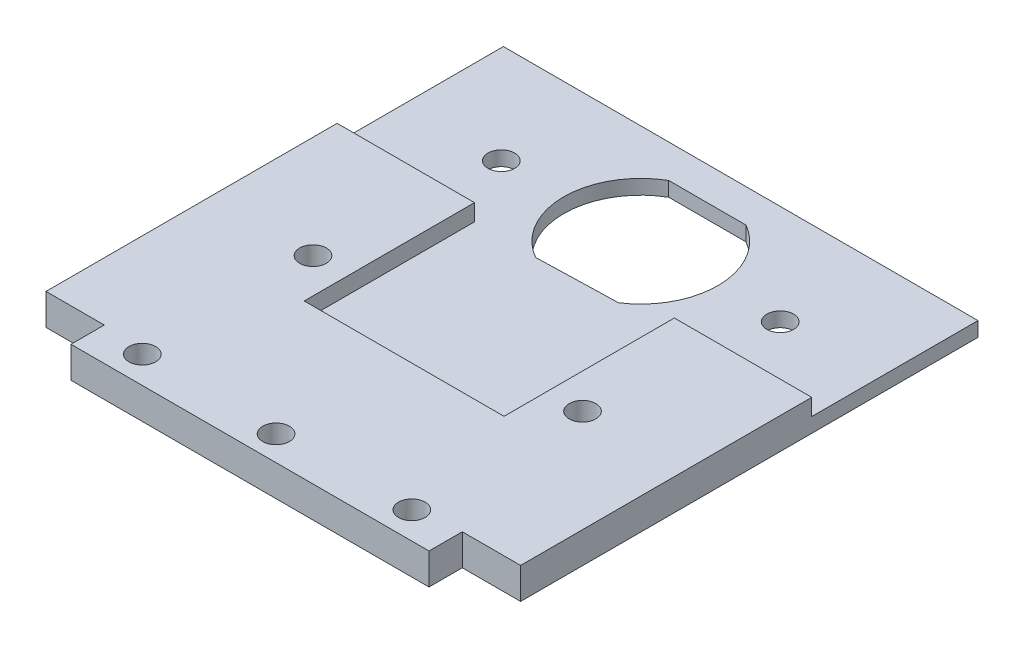
from build123d import *

# Parameters (mm, degrees)
AUFSATZ_LINEAR_AUSTRAGEN1_DEPTH = 3.75
SKIZZE16_W                      = 57
SKIZZE16_H                      = 19.970174162
SCHNITT_LINEAR_AUSTRAGEN6_DEPTH = 2
SCHNITT_LINEAR_AUSTRAGEN1_DEPTH = 2
SKIZZE10_R                      = 1.6
SCHNITT_LINEAR_AUSTRAGEN3_DEPTH = 3.2
SKIZZE17_R                      = 1.6
SCHNITT_LINEAR_AUSTRAGEN7_DEPTH = 4
SKIZZE18_W                      = 24
SKIZZE18_H                      = 20.451513558
SCHNITT_LINEAR_AUSTRAGEN8_DEPTH = 2
SKIZZE19_R                      = 1.6
SCHNITT_LINEAR_AUSTRAGEN9_DEPTH = 10


with BuildPart() as part:
    # Skizze1 → Aufsatz-Linear austragen1 (new body)
    with BuildSketch(Plane(origin=(0, 0, 0), x_dir=(1, 0, 0), z_dir=(0, 1, 0))):
        Polygon((0, 4), (7, 4), (7, 0), (17.778730529, 0), (38.778730529, 0), (50, 0), (50, 4), (57, 4), (57, 58.933855223), (0, 58.933855223), align=None)
    extrude(amount=-AUFSATZ_LINEAR_AUSTRAGEN1_DEPTH)

    # Skizze16 → Schnitt-Linear austragen6 (cut)
    with BuildSketch(Plane(origin=(0, 0, 0), x_dir=(1, 0, 0), z_dir=(0, 1, 0))):
        with Locations((28.5, 48.948768142)):
            Rectangle(SKIZZE16_W, SKIZZE16_H)
    extrude(amount=-SCHNITT_LINEAR_AUSTRAGEN6_DEPTH, mode=Mode.SUBTRACT)

    # Skizze3 → Schnitt-Linear austragen1 (cut)
    with BuildSketch(Plane(origin=(0, -2, 0), x_dir=(1, 0, 0), z_dir=(0, 1, 0))):
        with BuildLine():
            Line((33.565408487, 39.194078943), (23.856456095, 38.933855223))
            ThreePointArc((23.856456095, 38.933855223), (19.25, 46.933855223), (23.856456095, 54.933855223))
            Line((23.856456095, 54.933855223), (33.143543905, 54.933855223))
            ThreePointArc((33.143543905, 54.933855223), (37.746679321, 47.181688892), (33.565408487, 39.194078943))
        make_face()
    extrude(amount=-SCHNITT_LINEAR_AUSTRAGEN1_DEPTH, mode=Mode.SUBTRACT)

    # Skizze10 → Schnitt-Linear austragen3 (cut)
    with BuildSketch(Plane(origin=(0, -2, 0), x_dir=(1, 0, 0), z_dir=(0, 1, 0))):
        with Locations((45.25, 46.933855223)):
            Circle(SKIZZE10_R)
        with Locations((11.75, 46.933855223)):
            Circle(SKIZZE10_R)
    extrude(amount=-SCHNITT_LINEAR_AUSTRAGEN3_DEPTH, mode=Mode.SUBTRACT)

    # Skizze17 → Schnitt-Linear austragen7 (cut)
    with BuildSketch(Plane(origin=(0, 0, 0), x_dir=(1, 0, 0), z_dir=(0, 1, 0))):
        with Locations((44.684736485, 3.25)):
            Circle(SKIZZE17_R)
        with Locations((44.684736485, 23.75)):
            Circle(SKIZZE17_R)
        with Locations((12.315263515, 3.25)):
            Circle(SKIZZE17_R)
        with Locations((12.315263515, 23.75)):
            Circle(SKIZZE17_R)
    extrude(amount=-SCHNITT_LINEAR_AUSTRAGEN7_DEPTH, mode=Mode.SUBTRACT)

    # Skizze18 → Schnitt-Linear austragen8 (cut)
    with BuildSketch(Plane(origin=(0, 0, 0), x_dir=(1, 0, 0), z_dir=(0, 1, 0))):
        with Locations((28.5, 28.737924282)):
            Rectangle(SKIZZE18_W, SKIZZE18_H)
    extrude(amount=-SCHNITT_LINEAR_AUSTRAGEN8_DEPTH, mode=Mode.SUBTRACT)

    # Skizze19 → Schnitt-Linear austragen9 (cut)
    with BuildSketch(Plane(origin=(0, 0, 0), x_dir=(1, 0, 0), z_dir=(0, 1, 0))):
        with Locations((28.632488743, 2.995468967)):
            Circle(SKIZZE19_R)
    extrude(amount=-SCHNITT_LINEAR_AUSTRAGEN9_DEPTH, mode=Mode.SUBTRACT)


solid = part.part
